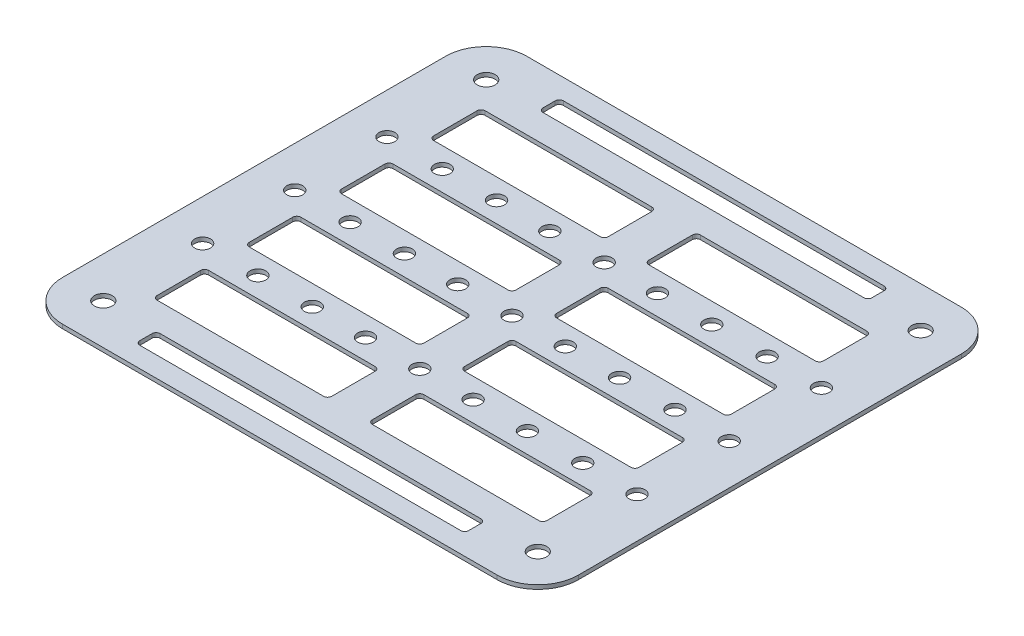
from build123d import *

# Parameters (mm, degrees)
SKETCH2_W                          = 127
SKETCH2_H                          = 114.3
BOSS_EXTRUDE1_DEPTH                = 1
FILLET1_R                          = 10
F_4_4_4_4_DIAMETER_HOLE1_D         = 4.4
CUT_EXTRUDE1_DEPTH                 = 171.863951728
CUT_EXTRUDE1_DEPTH_BACK            = 171.863951728
SKETCH5_W                          = 43
SKETCH5_H                          = 12.7
CUT_EXTRUDE2_DEPTH                 = 171.863951728
CUT_EXTRUDE2_DEPTH_BACK            = 171.863951728
SKETCH6_W                          = 81
SKETCH6_H                          = 5
F_3_9_3_9_DIAMETER_HOLE1_OUTLINE_R = 1.95
F_3_9_3_9_DIAMETER_HOLE1_DEPTH     = 1
FILLET2_R                          = 1


# Read off the part's stored shape, not the designer's step: Ø3.9 (3.9) Diameter Hole1
with BuildPart() as part:
    # Sketch2 → Boss-Extrude1 (new body)
    with BuildSketch(Plane(origin=(0, 0, 0), x_dir=(1, 0, 0), z_dir=(0, 1, 0))):
        with Locations((63.5, 57.15)):
            Rectangle(SKETCH2_W, SKETCH2_H)
    extrude(amount=BOSS_EXTRUDE1_DEPTH)

    # Fillet1
    fillet1_edges = [part.edges().sort_by_distance(p)[0] for p in [
        (0, 0.5, 0),
        (0, 0.5, -114.3),
        (127, 0.5, -114.3),
        (127, 0.5, 0),
    ]]
    fillet(fillet1_edges, radius=FILLET1_R)

    # Ø4.4 (4.4) Diameter Hole1 (through all)
    with Locations(Plane(origin=(0, 1, 0), x_dir=(1, 0, 0), z_dir=(0, 1, 0))):
        with Locations((10, 104.3), (117, 104.3), (10, 10), (117, 10)):
            Hole(F_4_4_4_4_DIAMETER_HOLE1_D / 2)

    # Sketch5 → Cut-Extrude1 (cut, two sides: drawn at the far end of the back side and taken through both)
    with BuildSketch(Plane(origin=(0, 1, 0), x_dir=(1, 0, 0), z_dir=(0, 1, 0)).offset(-CUT_EXTRUDE1_DEPTH_BACK)):
        with Locations((90, 68.5)):
            Rectangle(SKETCH5_W, SKETCH5_H)
        with Locations((37, 68.5)):
            Rectangle(SKETCH5_W, SKETCH5_H)
        with Locations((37, 91.2)):
            Rectangle(SKETCH5_W, SKETCH5_H)
        with Locations((90, 91.2)):
            Rectangle(SKETCH5_W, SKETCH5_H)
        with Locations((90, 23.1)):
            Rectangle(SKETCH5_W, SKETCH5_H)
        with Locations((90, 45.8)):
            Rectangle(SKETCH5_W, SKETCH5_H)
        with Locations((37, 45.8)):
            Rectangle(SKETCH5_W, SKETCH5_H)
        with Locations((37, 23.1)):
            Rectangle(SKETCH5_W, SKETCH5_H)
    extrude(amount=CUT_EXTRUDE1_DEPTH + CUT_EXTRUDE1_DEPTH_BACK, mode=Mode.SUBTRACT)

    # Sketch6 → Cut-Extrude2 (cut, two sides: drawn at the far end of the back side and taken through both)
    with BuildSketch(Plane(origin=(0, 1, 0), x_dir=(1, 0, 0), z_dir=(0, 1, 0)).offset(-CUT_EXTRUDE2_DEPTH_BACK)):
        with Locations((63.5, 106.8)):
            Rectangle(SKETCH6_W, SKETCH6_H)
        with Locations((63.5, 7.5)):
            Rectangle(SKETCH6_W, SKETCH6_H)
    extrude(amount=CUT_EXTRUDE2_DEPTH + CUT_EXTRUDE2_DEPTH_BACK, mode=Mode.SUBTRACT)

    # Ø3.9 (3.9) Diameter Hole1 outline → Ø3.9 (3.9) Diameter Hole1 (cut)
    with BuildSketch(Plane(origin=(0, 0, 0), x_dir=(1, 0, 0), z_dir=(0, 1, 0))):
        with Locations((117, 34.45)):
            Circle(F_3_9_3_9_DIAMETER_HOLE1_OUTLINE_R)
        with Locations((103.625, 34.45)):
            Circle(F_3_9_3_9_DIAMETER_HOLE1_OUTLINE_R)
        with Locations((76.625, 34.45)):
            Circle(F_3_9_3_9_DIAMETER_HOLE1_OUTLINE_R)
        with Locations((90, 34.45)):
            Circle(F_3_9_3_9_DIAMETER_HOLE1_OUTLINE_R)
        with Locations((50.125, 34.45)):
            Circle(F_3_9_3_9_DIAMETER_HOLE1_OUTLINE_R)
        with Locations((63.5, 34.45)):
            Circle(F_3_9_3_9_DIAMETER_HOLE1_OUTLINE_R)
        with Locations((23.625, 34.45)):
            Circle(F_3_9_3_9_DIAMETER_HOLE1_OUTLINE_R)
        with Locations((10, 34.45)):
            Circle(F_3_9_3_9_DIAMETER_HOLE1_OUTLINE_R)
        with Locations((37, 34.45)):
            Circle(F_3_9_3_9_DIAMETER_HOLE1_OUTLINE_R)
        with Locations((10, 57.15)):
            Circle(F_3_9_3_9_DIAMETER_HOLE1_OUTLINE_R)
        with Locations((23.625, 57.15)):
            Circle(F_3_9_3_9_DIAMETER_HOLE1_OUTLINE_R)
        with Locations((37, 57.15)):
            Circle(F_3_9_3_9_DIAMETER_HOLE1_OUTLINE_R)
        with Locations((50.125, 57.15)):
            Circle(F_3_9_3_9_DIAMETER_HOLE1_OUTLINE_R)
        with Locations((63.5, 57.15)):
            Circle(F_3_9_3_9_DIAMETER_HOLE1_OUTLINE_R)
        with Locations((76.625, 57.15)):
            Circle(F_3_9_3_9_DIAMETER_HOLE1_OUTLINE_R)
        with Locations((90, 57.15)):
            Circle(F_3_9_3_9_DIAMETER_HOLE1_OUTLINE_R)
        with Locations((103.625, 57.15)):
            Circle(F_3_9_3_9_DIAMETER_HOLE1_OUTLINE_R)
        with Locations((117, 79.85)):
            Circle(F_3_9_3_9_DIAMETER_HOLE1_OUTLINE_R)
        with Locations((103.625, 79.85)):
            Circle(F_3_9_3_9_DIAMETER_HOLE1_OUTLINE_R)
        with Locations((117, 57.15)):
            Circle(F_3_9_3_9_DIAMETER_HOLE1_OUTLINE_R)
        with Locations((76.625, 79.85)):
            Circle(F_3_9_3_9_DIAMETER_HOLE1_OUTLINE_R)
        with Locations((90, 79.85)):
            Circle(F_3_9_3_9_DIAMETER_HOLE1_OUTLINE_R)
        with Locations((50.125, 79.85)):
            Circle(F_3_9_3_9_DIAMETER_HOLE1_OUTLINE_R)
        with Locations((63.5, 79.85)):
            Circle(F_3_9_3_9_DIAMETER_HOLE1_OUTLINE_R)
        with Locations((23.625, 79.85)):
            Circle(F_3_9_3_9_DIAMETER_HOLE1_OUTLINE_R)
        with Locations((37, 79.85)):
            Circle(F_3_9_3_9_DIAMETER_HOLE1_OUTLINE_R)
        with Locations((10, 79.85)):
            Circle(F_3_9_3_9_DIAMETER_HOLE1_OUTLINE_R)
    extrude(amount=F_3_9_3_9_DIAMETER_HOLE1_DEPTH, mode=Mode.SUBTRACT)

    # Fillet2
    fillet2_edges = [part.edges().sort_by_distance(p)[0] for p in [
        (111.5, 0.5, -97.55),
        (111.5, 0.5, -84.85),
        (68.5, 0.5, -84.85),
        (68.5, 0.5, -97.55),
        (68.5, 0.5, -62.15),
        (68.5, 0.5, -74.85),
        (111.5, 0.5, -74.85),
        (111.5, 0.5, -62.15),
        (15.5, 0.5, -84.85),
        (15.5, 0.5, -97.55),
        (58.5, 0.5, -97.55),
        (58.5, 0.5, -84.85),
        (68.5, 0.5, -52.15),
        (111.5, 0.5, -52.15),
        (111.5, 0.5, -39.45),
        (68.5, 0.5, -39.45),
        (58.5, 0.5, -52.15),
        (58.5, 0.5, -39.45),
        (15.5, 0.5, -39.45),
        (15.5, 0.5, -52.15),
        (15.5, 0.5, -16.75),
        (15.5, 0.5, -29.45),
        (58.5, 0.5, -29.45),
        (58.5, 0.5, -16.75),
        (58.5, 0.5, -74.85),
        (58.5, 0.5, -62.15),
        (15.5, 0.5, -62.15),
        (15.5, 0.5, -74.85),
        (23, 0.5, -104.3),
        (23, 0.5, -109.3),
        (104, 0.5, -109.3),
        (104, 0.5, -104.3),
        (23, 0.5, -5),
        (23, 0.5, -10),
        (104, 0.5, -10),
        (104, 0.5, -5),
        (68.5, 0.5, -29.45),
        (111.5, 0.5, -29.45),
        (111.5, 0.5, -16.75),
        (68.5, 0.5, -16.75),
    ]]
    fillet(fillet2_edges, radius=FILLET2_R)


solid = part.part
